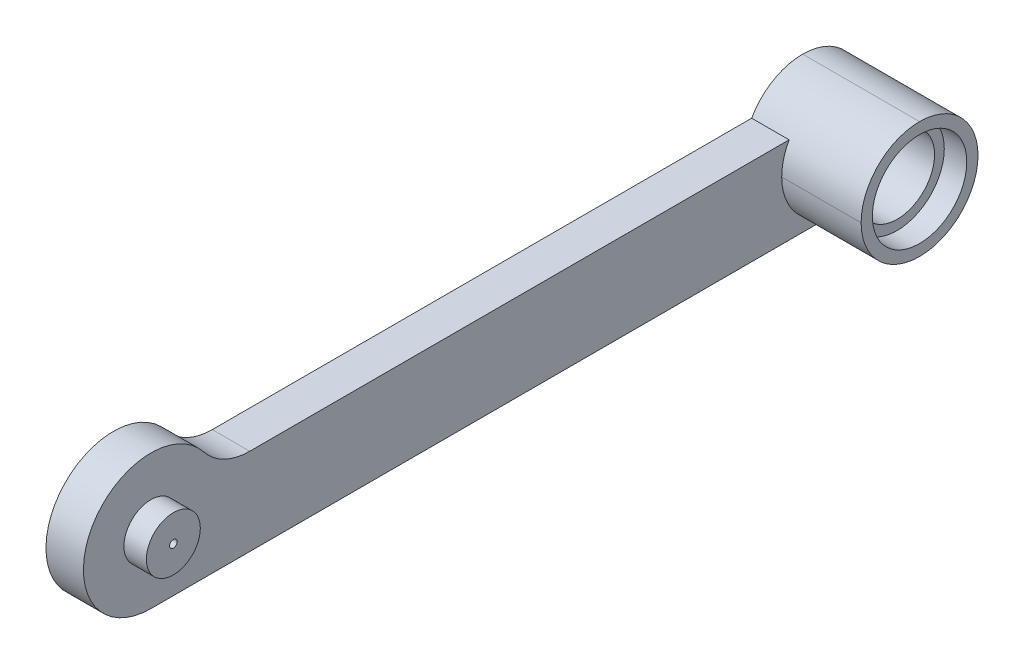
from build123d import *

# Parameters (mm, degrees)
SKETCH_1_R               = 4.5
SKETCH_1_W               = 49.9
SKETCH_1_H               = 7.8
EXTRUDE_1_DEPTH          = 2.5
EXTRUDE_START            = 2.5
SKETCH_1_6_R             = 1.8
SKETCH_1_6_R_2           = 0.25
EXTRUDE_3_DEPTH          = 1.5
SKETCH_1_5_W             = 7.8
SKETCH_1_5_H             = 7.8
EXTRUDE_2_DEPTH          = 7.8
SKETCH_1_7_R             = 2.5
CUT_EXTRUDE_1_DEPTH      = 51.706015422
SKETCH_1_8_R             = 3.15
SKETCH_1_8_R_2           = 2.5
CUT_EXTRUDE_2_DEPTH      = 1.5
CUT_EXTRUDE_START        = 6.3
SKETCH_1_9_R             = 3.15
SKETCH_1_9_R_2           = 2.5
CUT_EXTRUDE_3_DEPTH      = 1.5
SKETCH_2_W               = 0.191868154
SKETCH_2_H               = 2
SKETCH_2_W_2             = 37.6
CUT_EXTRUDE_4_DEPTH      = 51.706015422
FILLET_1_R               = 3.9
CUT_EXTRUDE_5_DEPTH      = 56.842188353
CUT_EXTRUDE_5_DEPTH_BACK = 56.842188353
SKETCH_3_W               = 64.704037325
SKETCH_3_H               = 20.946447886


with BuildPart() as part:
    # 草图1 → 凸台-拉伸1 (new body)
    with BuildSketch(Plane(origin=(0, 0, 0), x_dir=(0, 0, -1), z_dir=(1, 0, 0))):
        Circle(SKETCH_1_R)
        with Locations((24.95, -0.6)):
            Rectangle(SKETCH_1_W, SKETCH_1_H)
    extrude(amount=EXTRUDE_1_DEPTH)

    # 草图1<6> → 凸台-拉伸3 (add)
    with BuildSketch(Plane(origin=(0, 0, 0), x_dir=(0, 0, -1), z_dir=(1, 0, 0)).offset(EXTRUDE_START)):
        Circle(SKETCH_1_6_R)
        Circle(SKETCH_1_6_R_2, mode=Mode.SUBTRACT)
    extrude(amount=EXTRUDE_3_DEPTH)

    # 草图1<5> → 凸台-拉伸2 (add)
    with BuildSketch(Plane(origin=(0, 0, 0), x_dir=(0, 0, -1), z_dir=(1, 0, 0))):
        with Locations((46, -0.6)):
            Rectangle(SKETCH_1_5_W, SKETCH_1_5_H)
    extrude(amount=EXTRUDE_2_DEPTH)

    # 草图1<7> → 切除-拉伸1 (cut, through all)
    with BuildSketch(Plane(origin=(0, 0, 0), x_dir=(0, 0, -1), z_dir=(1, 0, 0))):
        with Locations((46, -0.6)):
            Circle(SKETCH_1_7_R)
    extrude(amount=CUT_EXTRUDE_1_DEPTH, mode=Mode.SUBTRACT)

    # 草图1<8> → 切除-拉伸2 (cut)
    with BuildSketch(Plane(origin=(0, 0, 0), x_dir=(0, 0, -1), z_dir=(1, 0, 0))):
        with Locations((46, -0.6)):
            Circle(SKETCH_1_8_R)
        with Locations((46, -0.6)):
            Circle(SKETCH_1_8_R_2, mode=Mode.SUBTRACT)
    extrude(amount=CUT_EXTRUDE_2_DEPTH, mode=Mode.SUBTRACT)

    # 草图1<9> → 切除-拉伸3 (cut)
    with BuildSketch(Plane(origin=(0, 0, 0), x_dir=(0, 0, -1), z_dir=(1, 0, 0)).offset(CUT_EXTRUDE_START)):
        with Locations((46, -0.6)):
            Circle(SKETCH_1_9_R)
        with Locations((46, -0.6)):
            Circle(SKETCH_1_9_R_2, mode=Mode.SUBTRACT)
    extrude(amount=CUT_EXTRUDE_3_DEPTH, mode=Mode.SUBTRACT)

    # 草图2 → 切除-拉伸4 (cut, through all)
    with BuildSketch(Plane.ZY):
        with BuildLine():
            Line((-3.059411708, 3.3), (-4.308131846, 3.3))
            Line((-4.308131846, 3.3), (-4.308131846, 1.3))
            ThreePointArc((-4.308131846, 1.3), (-3.817089795, 2.383238447), (-3.059411708, 3.3))
        make_face()
        with Locations((-4.404065923, 2.3)):
            Rectangle(SKETCH_2_W, SKETCH_2_H)
        with Locations((-23.3, 2.3)):
            Rectangle(SKETCH_2_W_2, SKETCH_2_H)
    extrude(amount=-CUT_EXTRUDE_4_DEPTH, mode=Mode.SUBTRACT)

    # 圆角1
    fillet_1_edges = [part.edges().sort_by_distance(p)[0] for p in [
        (1.25, 1.3, -4.308131846),
    ]]
    fillet(fillet_1_edges, radius=FILLET_1_R)
    fillet_1_2_edges = [part.edges().sort_by_distance(p)[0] for p in [
        (3.9, -4.5, -49.9),
        (3.9, 3.3, -49.9),
        (5.15, -4.5, -42.1),
        (3.9, 3.3, -42.1),
    ]]
    fillet(fillet_1_2_edges, radius=FILLET_1_R - 0.0001)  # a hair under: the kernel refuses the full size


with BuildPart() as body_2:
    # 镜向2: mirrored copy
    add(part.part.mirror(Plane.ZX.offset(-10)))

    # 草图3 → 切除-拉伸5 (cut, two sides: drawn at the far end of the back side and taken through both)
    with BuildSketch(Plane(origin=(2.5, 0, 0), x_dir=(0, 0, -1), z_dir=(1, 0, 0)).offset(-CUT_EXTRUDE_5_DEPTH_BACK)):
        with Locations((21.266459283, -20.282495136)):
            Rectangle(SKETCH_3_W, SKETCH_3_H)
    extrude(amount=CUT_EXTRUDE_5_DEPTH + CUT_EXTRUDE_5_DEPTH_BACK, mode=Mode.SUBTRACT)


solid = part.part
